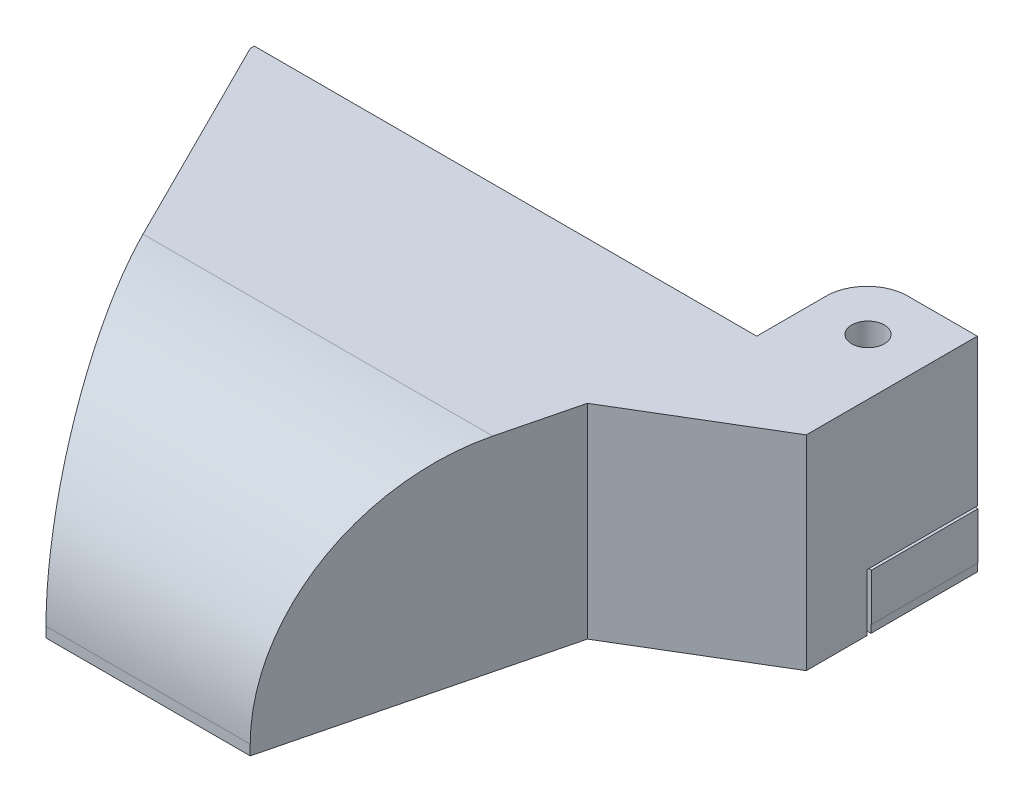
from build123d import *

# Parameters (mm, degrees)
SKETCH_1_W          = 30
SKETCH_1_H          = 6
EXTRUDE_1_DEPTH     = 2
SKETCH_2_R          = 0.8
CUT_EXTRUDE_1_DEPTH = 2
SKETCH_3_W          = 1.6
SKETCH_3_H          = 0.2
EXTRUDE_2_DEPTH     = 10
SKETCH_4_W          = 21.8
SKETCH_4_H          = 0.2
EXTRUDE_3_DEPTH     = 1.6
SKETCH_5_W          = 5
SKETCH_5_H          = 0.2
EXTRUDE_4_DEPTH     = 10
SKETCH_6_W          = 5.4
SKETCH_6_H          = 7.2
EXTRUDE_5_DEPTH     = 5.4
FILLET_1_R          = 2
SKETCH_7_R          = 0.8
CUT_EXTRUDE_2_DEPTH = 32.429922049
SKETCH_8_W          = 6
SKETCH_8_H          = 2
CUT_EXTRUDE_3_DEPTH = 33.86335345
SKETCH_9_W          = 21.8
SKETCH_9_H          = 1.6
EXTRUDE_7_DEPTH     = 0.2
EXTRUDE_9_DEPTH     = 1.6
EXTRUDE_10_REACH    = 42.578
EXTRUDE_11_DEPTH    = 1.6
CUT_EXTRUDE_4_DEPTH = 1.6
FILLET_2_R          = 9
FILLET_3_R          = 9.5
FILLET_4_R          = 1
CHAMFER_1_SIZE      = 9.620579793
CHAMFER_1_SIZE_2    = 7
SKETCH_16_W         = 5.26536988
SKETCH_16_H         = 5.208629253
EXTRUDE_12_DEPTH    = 0.4
SKETCH_17_W         = 0.8
SKETCH_17_H         = 5.208629253
EXTRUDE_13_DEPTH    = 2.3


with BuildPart() as part:
    # 草图1 → 凸台-拉伸1 (new body)
    with BuildSketch(Plane(origin=(0, 0, 0), x_dir=(1, 0, 0), z_dir=(0, 1, 0))):
        with Locations((15, -3)):
            Rectangle(SKETCH_1_W, SKETCH_1_H)
    extrude(amount=EXTRUDE_1_DEPTH)

    # 草图2 → 切除-拉伸1 (cut)
    with BuildSketch(Plane(origin=(0, 2, 0), x_dir=(1, 0, 0), z_dir=(0, 1, 0))):
        with Locations(Location((27.25, -3, 0), (0, 0, 270))):
            Circle(SKETCH_2_R)
    extrude(amount=-CUT_EXTRUDE_1_DEPTH, mode=Mode.SUBTRACT)

    # 草图3 → 凸台-拉伸2 (add)
    with BuildSketch(Plane(origin=(0, 2, 0), x_dir=(1, 0, 0), z_dir=(0, 1, 0))):
        with Locations((0.8, -5.9)):
            Rectangle(SKETCH_3_W, SKETCH_3_H)
        with Locations((24.2, -5.9)):
            Rectangle(SKETCH_3_W, SKETCH_3_H)
    extrude(amount=EXTRUDE_2_DEPTH)

    # 草图4 → 凸台-拉伸3 (add)
    with BuildSketch(Plane(origin=(0, 12, 0), x_dir=(1, 0, 0), z_dir=(0, 1, 0))):
        with Locations((12.5, -5.9)):
            Rectangle(SKETCH_4_W, SKETCH_4_H)
    extrude(amount=-EXTRUDE_3_DEPTH)

    # 草图5 → 凸台-拉伸4 (add)
    with BuildSketch(Plane(origin=(0, 2, 0), x_dir=(1, 0, 0), z_dir=(0, 1, 0))):
        with Locations((27.5, -5.9)):
            Rectangle(SKETCH_5_W, SKETCH_5_H)
    extrude(amount=EXTRUDE_4_DEPTH)

    # 草图6 → 凸台-拉伸5 (add)
    with BuildSketch(Plane(origin=(0, 0, 5.8), x_dir=(-1, 0, 0), z_dir=(0, 0, -1))):
        with Locations((-27.3, 8.4)):
            Rectangle(SKETCH_6_W, SKETCH_6_H)
    extrude(amount=EXTRUDE_5_DEPTH)

    # 圆角1
    fillet_1_edges = [part.edges().sort_by_distance(p)[0] for p in [
        (24.6, 8.4, 0.4),
    ]]
    fillet(fillet_1_edges, radius=FILLET_1_R)

    # 草图7 → 切除-拉伸2 (cut, through all)
    with BuildSketch(Plane(origin=(0, 4.8, 0), x_dir=(-1, 0, 0), z_dir=(0, -1, 0))):
        with Locations(Location((-27.25, -3, 0), (0, 0, 270))):
            Circle(SKETCH_7_R)
    extrude(amount=-CUT_EXTRUDE_2_DEPTH, mode=Mode.SUBTRACT)

    # 草图8 → 切除-拉伸3 (cut, through all)
    with BuildSketch(Plane.ZY):
        with Locations((3, 1)):
            Rectangle(SKETCH_8_W, SKETCH_8_H)
    extrude(amount=-CUT_EXTRUDE_3_DEPTH, mode=Mode.SUBTRACT)

    # 草图9 → 凸台-拉伸7 (add)
    with BuildSketch(Plane.XY.offset(6)):
        with Locations((12.5, 2.8)):
            Rectangle(SKETCH_9_W, SKETCH_9_H)
    extrude(amount=-EXTRUDE_7_DEPTH)

    # 草图11 → 凸台-拉伸9 (add)
    with BuildSketch(Plane(origin=(0, 2, 0), x_dir=(-1, 0, 0), z_dir=(0, -1, 0))):
        Polygon((0, -6), (-10, -26), (-20, -26), (-25, -6), align=None)
    extrude(amount=-EXTRUDE_9_DEPTH)

    # 凸台-拉伸10: up to this face of the body (flat: up to its plane)
    extrude_10_end = Plane(part.part.faces().sort_by_distance((25.077544524, 12, 3.686395467))[0])
    # 草图12 → 凸台-拉伸10 (add, up to the picked face)
    with BuildSketch(Plane(origin=(0, 3.6, 0), x_dir=(1, 0, 0), z_dir=(0, 1, 0)), mode=Mode.PRIVATE) as extrude_10_sk1:
        Polygon((2.588854382, -7.6), (10.988854382, -24.4), (18.75075775, -24.4), (22.95075775, -7.6), (23.4, -6), (25, -6), (20, -26), (10, -26), (0, -6), (1.6, -6), align=None)
    extrude_10_tool1 = split(extrude(extrude_10_sk1.sketch, amount=EXTRUDE_10_REACH, mode=Mode.PRIVATE), bisect_by=extrude_10_end, keep=Keep.BOTH, mode=Mode.PRIVATE)
    add(extrude_10_tool1.solids().sort_by(Axis((6.502498, 3.6, 16.143178), (0, 1, 0)))[0])

    # 草图13 → 凸台-拉伸11 (add)
    with BuildSketch(Plane(origin=(0, 12, 0), x_dir=(1, 0, 0), z_dir=(0, 1, 0))):
        Polygon((1.6, -5.8), (1.6, -6), (2.588854382, -7.6), (10.988854382, -24.4), (18.75075775, -24.4), (22.95075775, -7.6), (23.4, -6), (23.4, -5.8), align=None)
    extrude(amount=-EXTRUDE_11_DEPTH)

    # 草图15 → 切除-拉伸4 (cut)
    with BuildSketch(Plane.XZ.offset(-2)):
        Polygon((10.988854382, 24.4), (18.75075775, 24.4), (19.75075775, 20.4), (8.988854382, 20.4), align=None)
    extrude(amount=-CUT_EXTRUDE_4_DEPTH, mode=Mode.SUBTRACT)

    # 圆角2
    # the kernel refuses this fillet: 9 mm, written as the material it adds along each edge
    with BuildSketch(Plane(origin=(-11.461089939, 10.4, 24.4), x_dir=(0, -1, 0), z_dir=(1, 0, 0))) as fillet_2_piece_1_section:
        with BuildLine():
            CenterArc((9, 8.979977728), FILLET_2_R, 180, 86.177446271)
            Line((0, 8.979977728), (-0.18, 8.979977728))
            Line((-0.18, 8.979977728), (-0.18, 0))
            Line((-0.18, 0), (0, -0.18))
            ThreePointArc((0, -0.18), (4.2, -0.18), (8.388, -0.179599555))
            Line((8.388, -0.179599555), (8.4, 0))
        make_face()
    fillet_2_piece_1 = extrude(amount=52.661792009, mode=Mode.PRIVATE)
    fillet_2_piece_1 = split(fillet_2_piece_1, bisect_by=Plane(origin=(10.765391635, 8.588071481, 23.953074506), z_dir=(0.8944271909999129, 0, -0.447213595499964)), keep=Keep.TOP, mode=Mode.PRIVATE)
    fillet_2_piece_1 = split(fillet_2_piece_1, bisect_by=Plane(origin=(19.058612592, 8.588071481, 23.168580631), z_dir=(-0.9701425001453267, 0, -0.24253562503635406)), keep=Keep.TOP, mode=Mode.PRIVATE)
    add(fillet_2_piece_1)

    # 圆角3
    fillet_3_edges = [part.edges().sort_by_distance(p)[0] for p in [
        (15, 12, 26),
    ]]
    fillet(fillet_3_edges, radius=FILLET_3_R)

    # 圆角4
    fillet_4_edges = [part.edges().sort_by_distance(p)[0] for p in [
        (14.369806066, 3.6, 20.4),
    ]]
    fillet(fillet_4_edges, radius=FILLET_4_R)

    # 倒角1
    # the kernel refuses this chamfer: 9.620579793, 7 mm, written as the material it adds along each edge
    with BuildSketch(Plane(origin=(25, 12, 6), x_dir=(0.9998021063601228, 0, -0.019893418958582616), z_dir=(0, -1, 0))) as chamfer_1_piece_1_section:
        Polygon((CHAMFER_1_SIZE * 0.999802106371, CHAMFER_1_SIZE * 0.0198934189588), (-CHAMFER_1_SIZE_2 * 0.261787079984, CHAMFER_1_SIZE_2 * 0.965125652314), (0, 0), align=None)
    chamfer_1_piece_1 = extrude(amount=10, mode=Mode.PRIVATE)
    chamfer_1_piece_1 = split(chamfer_1_piece_1, bisect_by=Plane(origin=(30, 7, 8.595881011), z_dir=(-1, 0, 0)), keep=Keep.TOP, mode=Mode.PRIVATE)
    add(chamfer_1_piece_1)


with BuildPart() as body_2:
    # 草图16 → 凸台-拉伸12 (new body)
    with BuildSketch(Plane(origin=(0, 2, 0), x_dir=(-1, 0, 0), z_dir=(0, -1, 0))):
        with Locations((-27.36731506, -3.004314627)):
            Rectangle(SKETCH_16_W, SKETCH_16_H)
    extrude(amount=-EXTRUDE_12_DEPTH)

    # 草图17 → 凸台-拉伸13 (add)
    with BuildSketch(Plane(origin=(0, 2.4, 0), x_dir=(1, 0, 0), z_dir=(0, 1, 0))):
        with Locations((25.13463012, -3.004314627)):
            Rectangle(SKETCH_17_W, SKETCH_17_H)
        with Locations((26.63463012, -3.004314627)):
            Rectangle(SKETCH_17_W, SKETCH_17_H)
        with Locations((28.13463012, -3.004314627)):
            Rectangle(SKETCH_17_W, SKETCH_17_H)
        with Locations((29.63463012, -3.004314627)):
            Rectangle(SKETCH_17_W, SKETCH_17_H)
    extrude(amount=EXTRUDE_13_DEPTH)


solid = Compound([part.part, body_2.part])
